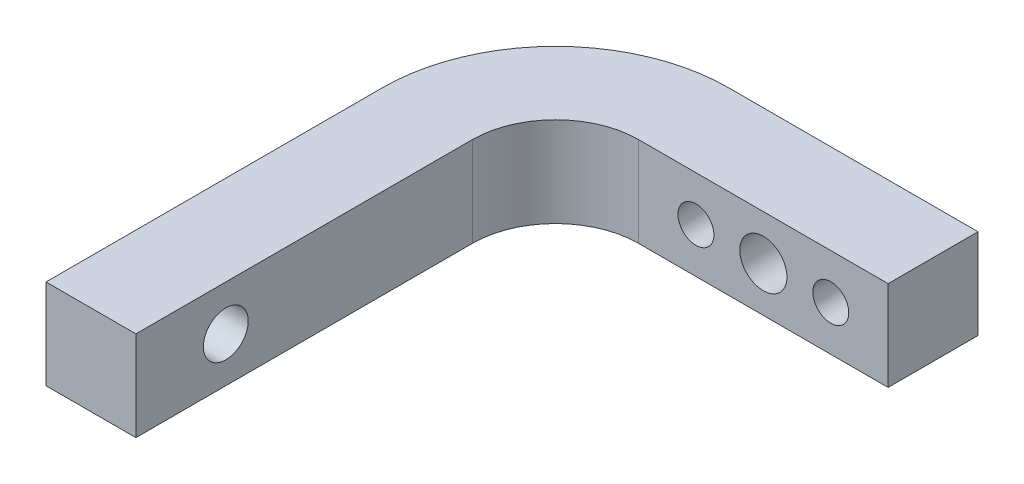
from build123d import *

# Parameters (mm, degrees)
BOSS_EXTRUDE1_DEPTH      = 4
BOSS_EXTRUDE1_DEPTH_BACK = 4
CUT_EXTRUDE1_DEPTH       = 55.294342247
CUT_EXTRUDE1_DEPTH_BACK  = 55.294342247
SKETCH2_R                = 2
SKETCH3_R                = 2.1
SKETCH3_R_2              = 1.6
CUT_EXTRUDE2_DEPTH       = 53.668449759


with BuildPart() as part:
    # Sketch1 → Boss-Extrude1 (new, two sides: drawn at the far end of the back side and taken through both)
    with BuildSketch(Plane(origin=(0, 0, 0), x_dir=(1, 0, 0), z_dir=(0, 1, 0)).offset(-BOSS_EXTRUDE1_DEPTH_BACK)):
        with BuildLine():
            Line((-11.1, 0), (11.1, 0))
            Line((11.1, 0), (11.1, -8))
            Line((11.1, -8), (-11.1, -8))
            ThreePointArc((-11.1, -8), (-16.332590181, -10.167409819), (-18.5, -15.4))
            Line((-18.5, -15.4), (-18.5, -45.34))
            Line((-18.5, -45.34), (-26.5, -45.34))
            Line((-26.5, -45.34), (-26.5, -15.4))
            ThreePointArc((-26.5, -15.4), (-21.98944443, -4.51055557), (-11.1, 0))
        make_face()
    extrude(amount=BOSS_EXTRUDE1_DEPTH + BOSS_EXTRUDE1_DEPTH_BACK)

    # Sketch2 → Cut-Extrude1 (cut, two sides: drawn at the far end of the back side and taken through both)
    with BuildSketch(Plane.ZY.offset(18.5).offset(-CUT_EXTRUDE1_DEPTH_BACK)):
        with Locations((37.34, 0)):
            Circle(SKETCH2_R)
    extrude(amount=CUT_EXTRUDE1_DEPTH + CUT_EXTRUDE1_DEPTH_BACK, mode=Mode.SUBTRACT)

    # Sketch3 → Cut-Extrude2 (cut, through all)
    with BuildSketch(Plane(origin=(0, 0, 0), x_dir=(-1, 0, 0), z_dir=(0, 0, -1))):
        Circle(SKETCH3_R)
        with Locations((-6, 0)):
            Circle(SKETCH3_R_2)
        with Locations((6, 0)):
            Circle(SKETCH3_R_2)
    extrude(amount=-CUT_EXTRUDE2_DEPTH, mode=Mode.SUBTRACT)


solid = part.part
